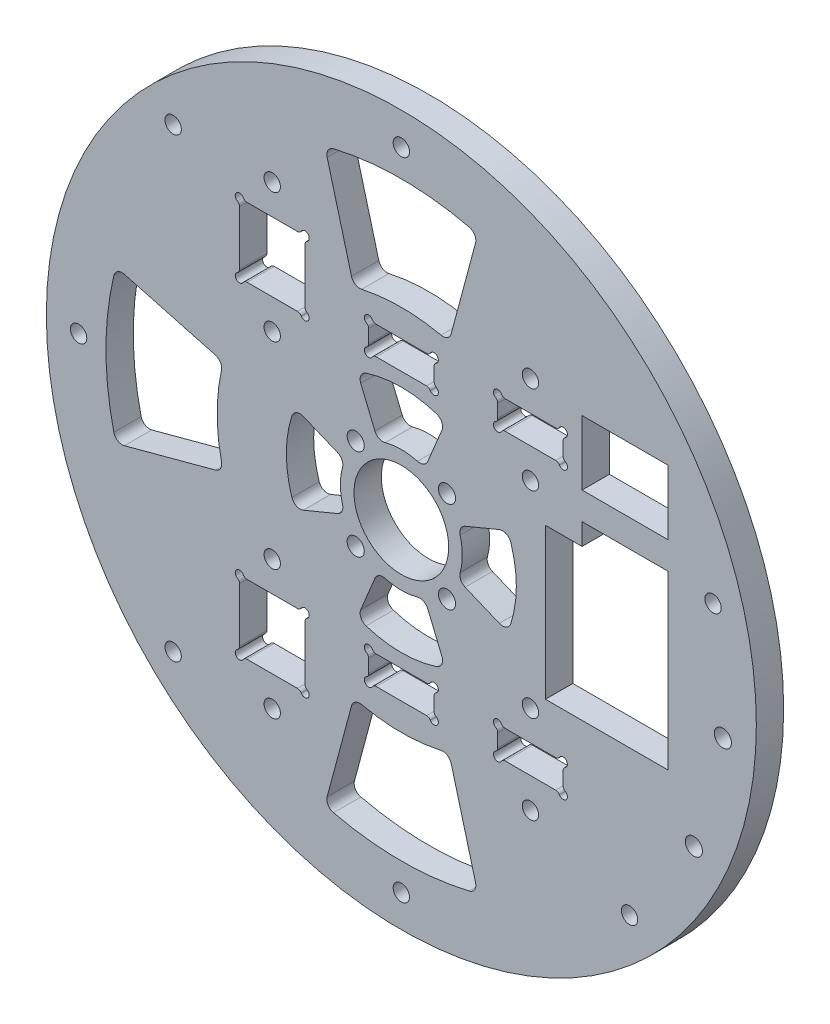
from build123d import *

# Parameters (mm, degrees)
SKETCH1_R                = 82.5
SKETCH1_R_2              = 1.89865
SKETCH1_R_3              = 1.9939
SKETCH1_R_4              = 11
BOSS_EXTRUDE1_DEPTH      = 6.35
SKETCH5_W                = 15.2
SKETCH5_H                = 16.075
CUT_EXTRUDE4_DEPTH       = 117.845293016
SKETCH6_R                = 1
CUT_EXTRUDE5_DEPTH       = 117.845293016
FILLET1_R                = 1
SKETCH10_W               = 53.521327686
SKETCH10_H               = 38.330479901
SKETCH10_W_2             = 53.671144578
SKETCH10_H_2             = 39.035756806
BOSS_EXTRUDE2_DEPTH      = 6.35
SKETCH11_W               = 15.2
SKETCH11_H               = 6.55
CUT_EXTRUDE8_DEPTH       = 117.845293016
SKETCH13_R               = 1
CUT_EXTRUDE9_DEPTH       = 117.845293016
FILLET2_R                = 1
LPATTERN3_COUNT          = 2
LPATTERN3_PITCH          = 30
FILLET2_OF_LPATTERN3_R   = 1
MIRROR3_DEPTH            = 6.35
SKETCH14_W               = 20
SKETCH14_H               = 15
CUT_EXTRUDE10_DEPTH      = 117.845293016
SKETCH15_R               = 1.89865
CUT_EXTRUDE12_DEPTH      = 117.845293016
CUT_EXTRUDE13_DEPTH      = 117.845293016
FILLET3_R                = 2
CIRPATTERN1_COUNT        = 4
FILLET3_OF_CIRPATTERN1_R = 2
CUT_EXTRUDE14_DEPTH      = 117.845293016
FILLET4_R                = 2
CIRPATTERN2_COUNT        = 4
FILLET4_OF_CIRPATTERN2_R = 2


# Read off the part's stored shape, not the designer's step: Mirror3
with BuildPart() as part:
    # Sketch1 → Boss-Extrude1 (new body)
    with BuildSketch(Plane.XY):
        Circle(SKETCH1_R)
        with Locations((72.444436972, 19.411428383)):
            Circle(SKETCH1_R_2, mode=Mode.SUBTRACT)
        with Locations((74.714602357, -6.536680706)):
            Circle(SKETCH1_R_3, mode=Mode.SUBTRACT)
        Circle(SKETCH1_R_4, mode=Mode.SUBTRACT)
        with Locations((67.973084028, -31.696369631)):
            Circle(SKETCH1_R_3, mode=Mode.SUBTRACT)
        with Locations((10.606601718, -10.606601718)):
            Circle(SKETCH1_R_3, mode=Mode.SUBTRACT)
        with Locations((0, -75)):
            Circle(SKETCH1_R_2, mode=Mode.SUBTRACT)
        with Locations((-10.606601718, -10.606601718)):
            Circle(SKETCH1_R_3, mode=Mode.SUBTRACT)
        with Locations((-10.606601718, 10.606601718)):
            Circle(SKETCH1_R_3, mode=Mode.SUBTRACT)
        with Locations((10.606601718, 10.606601718)):
            Circle(SKETCH1_R_3, mode=Mode.SUBTRACT)
        with Locations((-53.033008589, -53.033008589)):
            Circle(SKETCH1_R_2, mode=Mode.SUBTRACT)
        with Locations((-75, 0)):
            Circle(SKETCH1_R_2, mode=Mode.SUBTRACT)
        with Locations((-53.033008589, 53.033008589)):
            Circle(SKETCH1_R_2, mode=Mode.SUBTRACT)
        with Locations((0, 75)):
            Circle(SKETCH1_R_2, mode=Mode.SUBTRACT)
        with Locations((53.033008589, -53.033008589)):
            Circle(SKETCH1_R_2, mode=Mode.SUBTRACT)
    extrude(amount=BOSS_EXTRUDE1_DEPTH)

    # Sketch5 → Cut-Extrude4 (cut, through all)
    with BuildSketch(Plane.XY.offset(6.35)):
        with Locations((-30, -37.9375)):
            Rectangle(SKETCH5_W, SKETCH5_H)
        with Locations((-30, 37.9375)):
            Rectangle(SKETCH5_W, SKETCH5_H)
        with Locations((30, 37.9375)):
            Rectangle(SKETCH5_W, SKETCH5_H)
        with Locations((0, -37.9375)):
            Rectangle(SKETCH5_W, SKETCH5_H)
        with Locations((30, -37.9375)):
            Rectangle(SKETCH5_W, SKETCH5_H)
        with Locations((0, 37.9375)):
            Rectangle(SKETCH5_W, SKETCH5_H)
    extrude(amount=-CUT_EXTRUDE4_DEPTH, mode=Mode.SUBTRACT)

    # Sketch6 → Cut-Extrude5 (cut, through all)
    with BuildSketch(Plane.XY.offset(6.35)):
        with Locations((-37.6, 45.975)):
            Circle(SKETCH6_R)
        with Locations((-22.4, 45.975)):
            Circle(SKETCH6_R)
        with Locations((-37.6, 29.9)):
            Circle(SKETCH6_R)
        with Locations((-22.4, 29.9)):
            Circle(SKETCH6_R)
        with Locations((-7.6, 45.975)):
            Circle(SKETCH6_R)
        with Locations((7.6, 45.975)):
            Circle(SKETCH6_R)
        with Locations((-7.6, 29.9)):
            Circle(SKETCH6_R)
        with Locations((7.6, 29.9)):
            Circle(SKETCH6_R)
        with Locations((22.4, 45.975)):
            Circle(SKETCH6_R)
        with Locations((37.6, 45.975)):
            Circle(SKETCH6_R)
        with Locations((22.4, 29.9)):
            Circle(SKETCH6_R)
        with Locations((37.6, 29.9)):
            Circle(SKETCH6_R)
        with Locations((-37.6, -29.9)):
            Circle(SKETCH6_R)
        with Locations((-22.4, -29.9)):
            Circle(SKETCH6_R)
        with Locations((-37.6, -45.975)):
            Circle(SKETCH6_R)
        with Locations((-22.4, -45.975)):
            Circle(SKETCH6_R)
        with Locations((-7.6, -29.9)):
            Circle(SKETCH6_R)
        with Locations((7.6, -29.9)):
            Circle(SKETCH6_R)
        with Locations((-7.6, -45.975)):
            Circle(SKETCH6_R)
        with Locations((7.6, -45.975)):
            Circle(SKETCH6_R)
        with Locations((22.4, -29.9)):
            Circle(SKETCH6_R)
        with Locations((37.6, -29.9)):
            Circle(SKETCH6_R)
        with Locations((22.4, -45.975)):
            Circle(SKETCH6_R)
        with Locations((37.6, -45.975)):
            Circle(SKETCH6_R)
    extrude(amount=-CUT_EXTRUDE5_DEPTH, mode=Mode.SUBTRACT)

    # Fillet1
    fillet1_edges = [part.edges().sort_by_distance(p)[0] for p in [
        (-37.6, 44.975, 3.175),
        (-36.6, 45.975, 3.175),
        (-22.4, 44.975, 3.175),
        (-23.4, 45.975, 3.175),
        (-37.6, 30.9, 3.175),
        (-36.6, 29.9, 3.175),
        (-23.4, 29.9, 3.175),
        (-22.4, 30.9, 3.175),
        (-7.6, 44.975, 3.175),
        (-6.6, 45.975, 3.175),
        (7.6, 44.975, 3.175),
        (6.6, 45.975, 3.175),
        (-7.6, 30.9, 3.175),
        (-6.6, 29.9, 3.175),
        (6.6, 29.9, 3.175),
        (7.6, 30.9, 3.175),
        (22.4, 44.975, 3.175),
        (23.4, 45.975, 3.175),
        (37.6, 44.975, 3.175),
        (36.6, 45.975, 3.175),
        (22.4, 30.9, 3.175),
        (23.4, 29.9, 3.175),
        (36.6, 29.9, 3.175),
        (37.6, 30.9, 3.175),
        (-36.6, -29.9, 3.175),
        (-37.6, -30.9, 3.175),
        (-22.4, -30.9, 3.175),
        (-23.4, -29.9, 3.175),
        (-36.6, -45.975, 3.175),
        (-37.6, -44.975, 3.175),
        (-23.4, -45.975, 3.175),
        (-22.4, -44.975, 3.175),
        (-6.6, -29.9, 3.175),
        (-7.6, -30.9, 3.175),
        (7.6, -30.9, 3.175),
        (6.6, -29.9, 3.175),
        (-6.6, -45.975, 3.175),
        (-7.6, -44.975, 3.175),
        (6.6, -45.975, 3.175),
        (7.6, -44.975, 3.175),
        (23.4, -29.9, 3.175),
        (22.4, -30.9, 3.175),
        (37.6, -30.9, 3.175),
        (36.6, -29.9, 3.175),
        (23.4, -45.975, 3.175),
        (22.4, -44.975, 3.175),
        (36.6, -45.975, 3.175),
        (37.6, -44.975, 3.175),
    ]]
    fillet(fillet1_edges, radius=FILLET1_R)

    # Sketch10 → Boss-Extrude2 (add, through all)
    with BuildSketch(Plane(origin=(0, 0, 0), x_dir=(-1, 0, 0), z_dir=(0, 0, -1))):
        with Locations((-14.795735284, 41.600791801)):
            Rectangle(SKETCH10_W, SKETCH10_H)
        with Locations((-14.87064373, -42.15054159)):
            Rectangle(SKETCH10_W_2, SKETCH10_H_2)
    extrude(amount=-BOSS_EXTRUDE2_DEPTH)

    # Sketch11 → Cut-Extrude8 (cut, through all)
    with BuildSketch(Plane(origin=(0, 0, 0), x_dir=(-1, 0, 0), z_dir=(0, 0, -1))):
        with Locations((0, 33.175)):
            Rectangle(SKETCH11_W, SKETCH11_H)
    cut_extrude8 = extrude(amount=-CUT_EXTRUDE8_DEPTH, mode=Mode.SUBTRACT)

    # Sketch13 → Cut-Extrude9 (cut, through all)
    with BuildSketch(Plane(origin=(0, 0, 0), x_dir=(-1, 0, 0), z_dir=(0, 0, -1))):
        with Locations((-7.6, 36.45)):
            Circle(SKETCH13_R)
        with Locations((-7.6, 29.9)):
            Circle(SKETCH13_R)
        with Locations((7.6, 29.9)):
            Circle(SKETCH13_R)
        with Locations((7.6, 36.45)):
            Circle(SKETCH13_R)
    cut_extrude9 = extrude(amount=-CUT_EXTRUDE9_DEPTH, mode=Mode.SUBTRACT)

    # Fillet2
    fillet2_edges = [part.edges().sort_by_distance(p)[0] for p in [
        (6.6, 36.45, 3.175),
        (7.6, 35.45, 3.175),
        (-6.6, 36.45, 3.175),
        (7.6, 30.9, 3.175),
        (-6.6, 29.9, 3.175),
        (6.6, 29.9, 3.175),
        (-7.6, 30.9, 3.175),
        (-7.6, 35.45, 3.175),
    ]]
    fillet(fillet2_edges, radius=FILLET2_R)

    # LPattern3: Cut-Extrude8, Cut-Extrude9 ×2
    with Locations(*[(i * LPATTERN3_PITCH, 0, 0) for i in range(1, LPATTERN3_COUNT)]):
        add(cut_extrude8, mode=Mode.SUBTRACT)
        add(cut_extrude9, mode=Mode.SUBTRACT)

    # Fillet2 of LPattern3
    fillet2_of_lpattern3_edges = [part.edges().sort_by_distance(p)[0] for p in [
        (36.6, 36.45, 3.175),
        (37.6, 35.45, 3.175),
        (23.4, 36.45, 3.175),
        (37.6, 30.9, 3.175),
        (23.4, 29.9, 3.175),
        (36.6, 29.9, 3.175),
        (22.4, 30.9, 3.175),
        (22.4, 35.45, 3.175),
    ]]
    fillet(fillet2_of_lpattern3_edges, radius=FILLET2_OF_LPATTERN3_R)

    # Mirror3 outline → Mirror3 (cut)
    with BuildSketch(Plane.XY):
        with BuildLine():
            Line((-5.867949192, -36.45), (5.867949192, -36.45))
            ThreePointArc((5.867949192, -36.45), (6.367949192, -36.583974596), (6.733974596, -36.95))
            ThreePointArc((6.733974596, -36.95), (8.307106781, -37.157106781), (8.1, -35.583974596))
            ThreePointArc((8.1, -35.583974596), (7.733974596, -35.217949192), (7.6, -34.717949192))
            Line((7.6, -34.717949192), (7.6, -31.632050808))
            ThreePointArc((7.6, -31.632050808), (7.733974596, -31.132050808), (8.1, -30.766025404))
            ThreePointArc((8.1, -30.766025404), (8.307106781, -29.192893219), (6.733974596, -29.4))
            ThreePointArc((6.733974596, -29.4), (6.367949192, -29.766025404), (5.867949192, -29.9))
            Line((5.867949192, -29.9), (-5.867949192, -29.9))
            ThreePointArc((-5.867949192, -29.9), (-6.367949192, -29.766025404), (-6.733974596, -29.4))
            ThreePointArc((-6.733974596, -29.4), (-8.307106781, -29.192893219), (-8.1, -30.766025404))
            ThreePointArc((-8.1, -30.766025404), (-7.733974596, -31.132050808), (-7.6, -31.632050808))
            Line((-7.6, -31.632050808), (-7.6, -34.717949192))
            ThreePointArc((-7.6, -34.717949192), (-7.733974596, -35.217949192), (-8.1, -35.583974596))
            ThreePointArc((-8.1, -35.583974596), (-8.307106781, -37.157106781), (-6.733974596, -36.95))
            ThreePointArc((-6.733974596, -36.95), (-6.367949192, -36.583974596), (-5.867949192, -36.45))
        make_face()
        with BuildLine():
            Line((24.132050808, -36.45), (35.867949192, -36.45))
            ThreePointArc((35.867949192, -36.45), (36.367949192, -36.583974596), (36.733974596, -36.95))
            ThreePointArc((36.733974596, -36.95), (38.307106781, -37.157106781), (38.1, -35.583974596))
            ThreePointArc((38.1, -35.583974596), (37.733974596, -35.217949192), (37.6, -34.717949192))
            Line((37.6, -34.717949192), (37.6, -31.632050808))
            ThreePointArc((37.6, -31.632050808), (37.733974596, -31.132050808), (38.1, -30.766025404))
            ThreePointArc((38.1, -30.766025404), (38.307106781, -29.192893219), (36.733974596, -29.4))
            ThreePointArc((36.733974596, -29.4), (36.367949192, -29.766025404), (35.867949192, -29.9))
            Line((35.867949192, -29.9), (24.132050808, -29.9))
            ThreePointArc((24.132050808, -29.9), (23.632050808, -29.766025404), (23.266025404, -29.4))
            ThreePointArc((23.266025404, -29.4), (21.692893219, -29.192893219), (21.9, -30.766025404))
            ThreePointArc((21.9, -30.766025404), (22.266025404, -31.132050808), (22.4, -31.632050808))
            Line((22.4, -31.632050808), (22.4, -34.717949192))
            ThreePointArc((22.4, -34.717949192), (22.266025404, -35.217949192), (21.9, -35.583974596))
            ThreePointArc((21.9, -35.583974596), (21.692893219, -37.157106781), (23.266025404, -36.95))
            ThreePointArc((23.266025404, -36.95), (23.632050808, -36.583974596), (24.132050808, -36.45))
        make_face()
    extrude(amount=MIRROR3_DEPTH, mode=Mode.SUBTRACT)

    # Sketch14 → Cut-Extrude10 (cut, through all)
    with BuildSketch(Plane.XY):
        Polygon((42, 20.65), (62, 20.65), (62, -19.35), (33.5, -19.35), (33.5, 15.65), (42, 15.65), align=None)
        with Locations((52, 34.5)):
            Rectangle(SKETCH14_W, SKETCH14_H)
    extrude(amount=CUT_EXTRUDE10_DEPTH, mode=Mode.SUBTRACT)

    # Sketch15 → Cut-Extrude12 (cut, through all)
    with BuildSketch(Plane.XY.offset(6.35)):
        with Locations((-30, 52.975)):
            Circle(SKETCH15_R)
        with Locations((-30, 22.9)):
            Circle(SKETCH15_R)
        with Locations((30, 43.45)):
            Circle(SKETCH15_R)
        with Locations((30, 22.9)):
            Circle(SKETCH15_R)
    cut_extrude12 = extrude(amount=-CUT_EXTRUDE12_DEPTH, mode=Mode.SUBTRACT)

    # Mirror4: Cut-Extrude12 across plane
    add(cut_extrude12.mirror(Plane.ZX), mode=Mode.SUBTRACT)

    # Sketch16 → Cut-Extrude13 (cut, through all)
    with BuildSketch(Plane.XY.offset(6.35)):
        with BuildLine():
            Line((-10.22721473, -24.690680506), (-5.424537654, -13.095992373))
            ThreePointArc((-5.424537654, -13.095992373), (0, -14.175), (5.424537654, -13.095992373))
            Line((5.424537654, -13.095992373), (10.22721473, -24.690680506))
            ThreePointArc((10.22721473, -24.690680506), (0, -26.725), (-10.22721473, -24.690680506))
        make_face()
    cut_extrude13 = extrude(amount=-CUT_EXTRUDE13_DEPTH, mode=Mode.SUBTRACT)

    # Fillet3
    fillet3_edges = [part.edges().sort_by_distance(p)[0] for p in [
        (-5.424537654, -13.095992373, 3.175),
        (5.424537654, -13.095992373, 3.175),
        (10.22721473, -24.690680506, 3.175),
        (-10.22721473, -24.690680506, 3.175),
    ]]
    fillet(fillet3_edges, radius=FILLET3_R)

    # CirPattern1: Cut-Extrude13 ×4 about axis
    cirpattern1_axis = Axis((0, 0, 0), (0, 0, 1))
    for i in range(1, CIRPATTERN1_COUNT):
        add(cut_extrude13.rotate(cirpattern1_axis, i * 360 / CIRPATTERN1_COUNT), mode=Mode.SUBTRACT)

    # Fillet3 of CirPattern1
    fillet3_of_cirpattern1_edges = [part.edges().sort_by_distance(p)[0] for p in [
        (13.095992373, -5.424537654, 3.175),
        (13.095992373, 5.424537654, 3.175),
        (24.690680506, 10.22721473, 3.175),
        (24.690680506, -10.22721473, 3.175),
        (5.424537654, 13.095992373, 3.175),
        (-5.424537654, 13.095992373, 3.175),
        (-10.22721473, 24.690680506, 3.175),
        (10.22721473, 24.690680506, 3.175),
        (-13.095992373, 5.424537654, 3.175),
        (-13.095992373, -5.424537654, 3.175),
        (-24.690680506, -10.22721473, 3.175),
        (-24.690680506, 10.22721473, 3.175),
    ]]
    fillet(fillet3_of_cirpattern1_edges, radius=FILLET3_OF_CIRPATTERN1_R)

    # Sketch17 → Cut-Extrude14 (cut, through all)
    with BuildSketch(Plane.XY.offset(6.35)):
        with BuildLine():
            Line((-17.767927446, -66.310807975), (-11.07745513, -41.341625365))
            ThreePointArc((-11.07745513, -41.341625365), (0, -42.8), (11.07745513, -41.341625365))
            Line((11.07745513, -41.341625365), (17.767927446, -66.310807975))
            ThreePointArc((17.767927446, -66.310807975), (0, -68.65), (-17.767927446, -66.310807975))
        make_face()
    cut_extrude14 = extrude(amount=-CUT_EXTRUDE14_DEPTH, mode=Mode.SUBTRACT)

    # Fillet4
    fillet4_edges = [part.edges().sort_by_distance(p)[0] for p in [
        (-11.07745513, -41.341625365, 3.175),
        (11.07745513, -41.341625365, 3.175),
        (17.767927446, -66.310807975, 3.175),
        (-17.767927446, -66.310807975, 3.175),
    ]]
    fillet(fillet4_edges, radius=FILLET4_R)

    # CirPattern2: Cut-Extrude14 ×4 about axis, 1 skipped
    cirpattern2_axis = Axis((0, 0, 0), (0, 0, -1))
    add([cut_extrude14.rotate(cirpattern2_axis, i * 360 / CIRPATTERN2_COUNT) for i in range(1, CIRPATTERN2_COUNT) if i not in (3,)], mode=Mode.SUBTRACT)

    # Fillet4 of CirPattern2
    fillet4_of_cirpattern2_edges = [part.edges().sort_by_distance(p)[0] for p in [
        (-41.341625365, 11.07745513, 3.175),
        (-41.341625365, -11.07745513, 3.175),
        (-66.310807975, -17.767927446, 3.175),
        (-66.310807975, 17.767927446, 3.175),
        (11.07745513, 41.341625365, 3.175),
        (-11.07745513, 41.341625365, 3.175),
        (-17.767927446, 66.310807975, 3.175),
        (17.767927446, 66.310807975, 3.175),
    ]]
    fillet(fillet4_of_cirpattern2_edges, radius=FILLET4_OF_CIRPATTERN2_R)


solid = part.part
